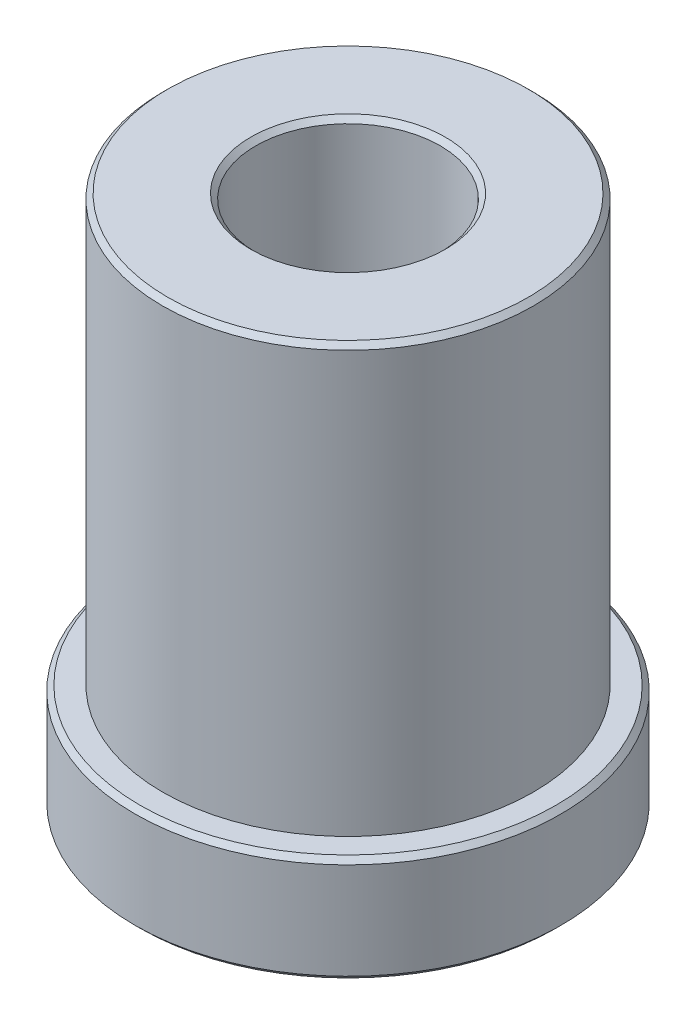
from build123d import *

# Parameters (mm, degrees)
SKETCH1_R           = 11.049
BOSS_EXTRUDE1_DEPTH = 25.4
SKETCH2_R           = 12.7
BOSS_EXTRUDE2_DEPTH = 6.35
SKETCH5_R           = 11.176
CUT_EXTRUDE2_DEPTH  = 5.545328
SKETCH6_R           = 7.27456
CUT_EXTRUDE3_DEPTH  = 0.1999996
SKETCH3_R           = 5.500000049
CUT_EXTRUDE1_DEPTH  = 37.477972806
CHAMFER1_SIZE       = 0.299999908


with BuildPart() as part:
    # Sketch1 → Boss-Extrude1 (new body)
    with BuildSketch(Plane(origin=(0, 0, 0), x_dir=(1, 0, 0), z_dir=(0, 1, 0))):
        Circle(SKETCH1_R)
    extrude(amount=BOSS_EXTRUDE1_DEPTH)

    # Sketch2 → Boss-Extrude2 (add)
    with BuildSketch(Plane.XZ):
        Circle(SKETCH2_R)
    extrude(amount=BOSS_EXTRUDE2_DEPTH)

    # Sketch5 → Cut-Extrude2 (cut)
    with BuildSketch(Plane.XZ.offset(6.35)):
        Circle(SKETCH5_R)
    extrude(amount=-CUT_EXTRUDE2_DEPTH, mode=Mode.SUBTRACT)

    # Sketch6 → Cut-Extrude3 (cut)
    with BuildSketch(Plane.XZ.offset(0.804672)):
        Circle(SKETCH6_R)
    extrude(amount=-CUT_EXTRUDE3_DEPTH, mode=Mode.SUBTRACT)

    # Sketch3 → Cut-Extrude1 (cut, through all)
    with BuildSketch(Plane.XZ.offset(6.35)):
        Circle(SKETCH3_R)
    extrude(amount=-CUT_EXTRUDE1_DEPTH, mode=Mode.SUBTRACT)

    # Chamfer1
    chamfer1_edges = [part.edges().sort_by_distance(p)[0] for p in [
        (-12.7, 0, 0),
        (-12.7, -6.35, 0),
        (-11.049, 25.4, 0),
        (-5.500000049, 25.4, 0),
        (-5.500000049, -0.6046724, 0),
        (-11.176, -6.35, 0),
    ]]
    chamfer(chamfer1_edges, length=CHAMFER1_SIZE)


solid = part.part
